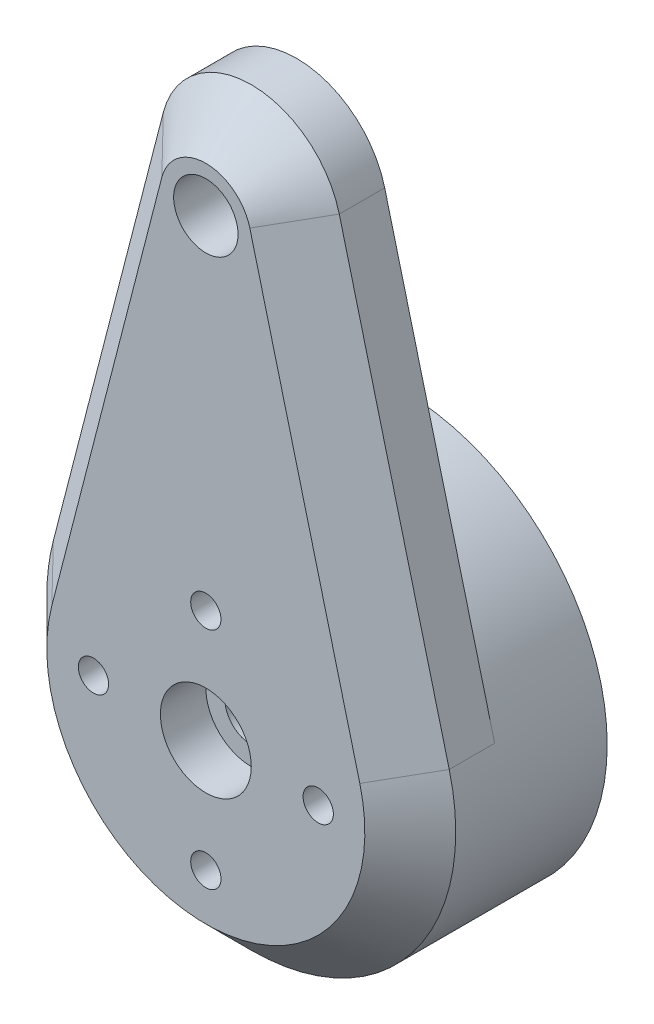
from build123d import *

# Parameters (mm, degrees)
SKETCH1_R           = 2.125
BOSS_EXTRUDE1_DEPTH = 6
BOSS_EXTRUDE2_START = 7
SKETCH4_R           = 13.5
BOSS_EXTRUDE2_DEPTH = 7
SKETCH6_R           = 11
CUT_EXTRUDE4_DEPTH  = 4
SKETCH5_R           = 1
SKETCH5_R_2         = 1.75
CUT_EXTRUDE2_DEPTH  = 40.487339743
CHAMFER1_SIZE       = 3
SKETCH7_R           = 3
CUT_EXTRUDE5_DEPTH  = 3


with BuildPart() as part:
    # Sketch1 → Boss-Extrude1 (new body)
    with BuildSketch(Plane.XY):
        with BuildLine():
            Line((-5.809475019, 31.5), (-13.071318793, 3.375))
            ThreePointArc((-13.071318793, 3.375), (0, -13.5), (13.071318793, 3.375))
            Line((13.071318793, 3.375), (5.809475019, 31.5))
            ThreePointArc((5.809475019, 31.5), (0, 36), (-5.809475019, 31.5))
        make_face()
        with Locations((0, 30)):
            Circle(SKETCH1_R, mode=Mode.SUBTRACT)
    extrude(amount=BOSS_EXTRUDE1_DEPTH)

    # Sketch4 → Boss-Extrude2 (add)
    with BuildSketch(Plane(origin=(0, 0, 0), x_dir=(-1, 0, 0), z_dir=(0, 0, -1)).offset(BOSS_EXTRUDE2_START)):
        Circle(SKETCH4_R)
    extrude(amount=-BOSS_EXTRUDE2_DEPTH)

    # Sketch6 → Cut-Extrude4 (cut)
    with BuildSketch(Plane(origin=(0, 0, -7), x_dir=(-1, 0, 0), z_dir=(0, 0, -1))):
        Circle(SKETCH6_R)
    extrude(amount=-CUT_EXTRUDE4_DEPTH, mode=Mode.SUBTRACT)

    # Sketch5 → Cut-Extrude2 (cut, through all)
    with BuildSketch(Plane(origin=(0, 0, -3), x_dir=(-1, 0, 0), z_dir=(0, 0, -1))):
        with Locations((7.42, 0)):
            Circle(SKETCH5_R)
        with Locations((0, -7.42)):
            Circle(SKETCH5_R)
        with Locations((-7.42, 0)):
            Circle(SKETCH5_R)
        with Locations((0, 7.42)):
            Circle(SKETCH5_R)
        Circle(SKETCH5_R_2)
    extrude(amount=-CUT_EXTRUDE2_DEPTH, mode=Mode.SUBTRACT)

    # Chamfer1
    chamfer1_edges = [part.edges().sort_by_distance(p)[0] for p in [
        (0, -13.5, 6),
        (-9.440396906, 17.4375, 6),
        (0, 36, 6),
        (9.440396906, 17.4375, 6),
    ]]
    chamfer(chamfer1_edges, length=CHAMFER1_SIZE)

    # Sketch7 → Cut-Extrude5 (cut)
    with BuildSketch(Plane.XY.offset(6)):
        Circle(SKETCH7_R)
    extrude(amount=-CUT_EXTRUDE5_DEPTH, mode=Mode.SUBTRACT)


solid = part.part
